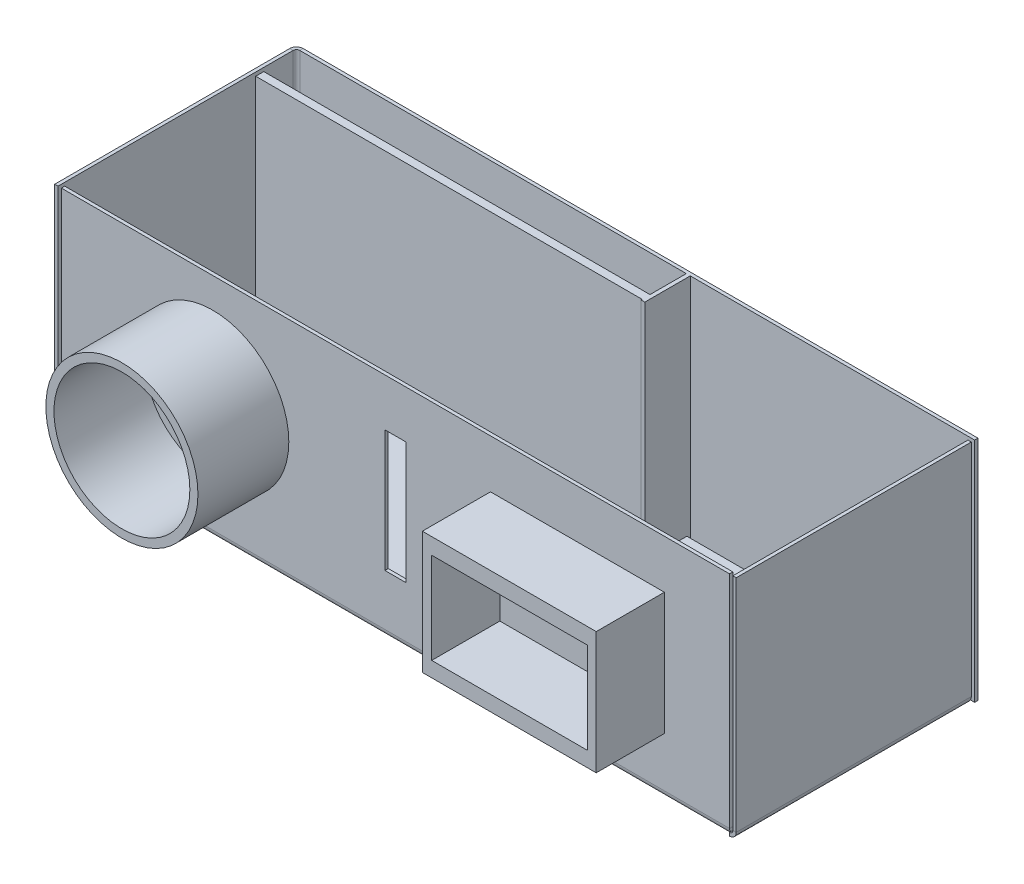
from build123d import *

# Parameters (mm, degrees)
SKETCH1_W                    = 150
SKETCH1_H                    = 50
BASE_FLANGE1_DEPTH           = 0.7366
EDGE_FLANGE2_STRIP_W         = 4.4196
EDGE_FLANGE2_STRIP_H         = 0.7366
EDGE_FLANGE2_STRIP_CUT_DEPTH = 50
EDGE_FLANGE2_DEPTH           = 50
EDGE_FLANGE3_STRIP_W         = 4.4196
EDGE_FLANGE3_STRIP_H         = 0.7366
EDGE_FLANGE3_STRIP_CUT_DEPTH = 51.7366
EDGE_FLANGE3_DEPTH           = 51.7366
EDGE_FLANGE5_STRIP_W         = 4.4196
EDGE_FLANGE5_STRIP_H         = 0.7366
EDGE_FLANGE5_STRIP_CUT_DEPTH = 51.7366
EDGE_FLANGE5_DEPTH           = 51.7366
EDGE_FLANGE6_STRIP_W         = 4.4196
EDGE_FLANGE6_STRIP_H         = 0.7366
EDGE_FLANGE6_STRIP_CUT_DEPTH = 147.0536
EDGE_FLANGE6_DEPTH           = 147.0536
SKETCH38_W                   = 4.66509895
SKETCH38_H                   = 26.811141958
CUT_EXTRUDE1_DEPTH           = 2
SKETCH40_R                   = 16.736303479
SKETCH40_R_2                 = 14.955594907
BOSS_EXTRUDE4_DEPTH          = 20
SKETCH42_W                   = 0.865074657
SKETCH42_H                   = 50
BOSS_EXTRUDE5_DEPTH          = 10
SKETCH57_W                   = 1.770321067
SKETCH57_H                   = 56.722896859
BOSS_EXTRUDE7_DEPTH          = 85
SKETCH60_W                   = 38.271407539
SKETCH60_H                   = 26.924897386
SKETCH60_W_2                 = 34.235775553
SKETCH60_H_2                 = 20.047107357
BOSS_EXTRUDE8_DEPTH          = 15
SKETCH61_R                   = 2.019782533
CUT_EXTRUDE3_DEPTH           = 2
SKETCH62_R                   = 1.571954748
BOSS_EXTRUDE9_DEPTH          = 3
SKETCH63_R                   = 7.10603058
BOSS_EXTRUDE10_DEPTH         = 1.5
SKETCH64_R                   = 6.980489156
SKETCH64_R_2                 = 6.226740222
BOSS_EXTRUDE11_DEPTH         = 15


# Sheet-metal steps are written as plain solids
with BuildPart() as part:
    # Sketch1 → Base-Flange1 (new body)
    with BuildSketch(Plane.XY):
        Rectangle(SKETCH1_W, SKETCH1_H)
    extrude(amount=-BASE_FLANGE1_DEPTH)

    # Edge-Flange2 strip (across the edge) → Edge-Flange2 strip cut (cut)
    with BuildSketch(Plane(origin=(-75, 25, 0), x_dir=(1, 0, 0), z_dir=(0, -1, 0))):
        with Locations((-0.7366, -0.3683)):
            Rectangle(EDGE_FLANGE2_STRIP_W, EDGE_FLANGE2_STRIP_H)
    extrude(amount=EDGE_FLANGE2_STRIP_CUT_DEPTH, mode=Mode.SUBTRACT)

    # Edge-Flange2 section (across the edge) → Edge-Flange2 (add)
    with BuildSketch(Plane(origin=(-75, 25, 0), x_dir=(1, 0, 0), z_dir=(0, -1, 0))):
        with BuildLine():
            Line((0, 0.7366), (0, 52.4732))
            Line((0, 52.4732), (0.7366, 52.4732))
            Line((0.7366, 52.4732), (0.7366, 0.7366))
            ThreePointArc((0.7366, 0.7366), (0.952345145, 0.215745145), (1.4732, 0))
            Line((1.4732, 0), (1.4732, -0.7366))
            ThreePointArc((1.4732, -0.7366), (0.43149029, -0.30510971), (0, 0.7366))
        make_face()
    extrude(amount=EDGE_FLANGE2_DEPTH)

    # Edge-Flange3 strip (across the edge) → Edge-Flange3 strip cut (cut)
    with BuildSketch(Plane(origin=(-74.2634, -25, 52.4732), x_dir=(0, 1, 0), z_dir=(0, 0, -1))):
        with Locations((-0.7366, -0.3683)):
            Rectangle(EDGE_FLANGE3_STRIP_W, EDGE_FLANGE3_STRIP_H)
    extrude(amount=EDGE_FLANGE3_STRIP_CUT_DEPTH, mode=Mode.SUBTRACT)

    # Edge-Flange3 section (across the edge) → Edge-Flange3 (add)
    with BuildSketch(Plane(origin=(-74.2634, -25, 52.4732), x_dir=(0, 1, 0), z_dir=(0, 0, -1))):
        with BuildLine():
            Line((0, 0.7366), (0, 149.2634))
            Line((0, 149.2634), (0.7366, 149.2634))
            Line((0.7366, 149.2634), (0.7366, 0.7366))
            ThreePointArc((0.7366, 0.7366), (0.952345145, 0.215745145), (1.4732, 0))
            Line((1.4732, 0), (1.4732, -0.7366))
            ThreePointArc((1.4732, -0.7366), (0.43149029, -0.30510971), (0, 0.7366))
        make_face()
    extrude(amount=EDGE_FLANGE3_DEPTH)

    # Edge-Flange5 strip (across the edge) → Edge-Flange5 strip cut (cut)
    with BuildSketch(Plane(origin=(75, -24.2634, 52.4732), x_dir=(-1, 0, 0), z_dir=(0, 0, -1))):
        with Locations((-0.7366, -0.3683)):
            Rectangle(EDGE_FLANGE5_STRIP_W, EDGE_FLANGE5_STRIP_H)
    extrude(amount=EDGE_FLANGE5_STRIP_CUT_DEPTH, mode=Mode.SUBTRACT)

    # Edge-Flange5 section (across the edge) → Edge-Flange5 (add)
    with BuildSketch(Plane(origin=(75, -24.2634, 52.4732), x_dir=(-1, 0, 0), z_dir=(0, 0, -1))):
        with BuildLine():
            Line((0, 0.7366), (0, 49.2634))
            Line((0, 49.2634), (0.7366, 49.2634))
            Line((0.7366, 49.2634), (0.7366, 0.7366))
            ThreePointArc((0.7366, 0.7366), (0.952345145, 0.215745145), (1.4732, 0))
            Line((1.4732, 0), (1.4732, -0.7366))
            ThreePointArc((1.4732, -0.7366), (0.43149029, -0.30510971), (0, 0.7366))
        make_face()
    extrude(amount=EDGE_FLANGE5_DEPTH)

    # Edge-Flange6 strip (across the edge) → Edge-Flange6 strip cut (cut)
    with BuildSketch(Plane(origin=(-73.5268, -24.2634, 52.4732), x_dir=(0, 0, -1), z_dir=(1, 0, 0))):
        with Locations((-0.7366, -0.3683)):
            Rectangle(EDGE_FLANGE6_STRIP_W, EDGE_FLANGE6_STRIP_H)
    extrude(amount=EDGE_FLANGE6_STRIP_CUT_DEPTH, mode=Mode.SUBTRACT)

    # Edge-Flange6 section (across the edge) → Edge-Flange6 (add)
    with BuildSketch(Plane(origin=(-73.5268, -24.2634, 52.4732), x_dir=(0, 0, -1), z_dir=(1, 0, 0))):
        with BuildLine():
            Line((0, 0.7366), (0, 49.2634))
            Line((0, 49.2634), (0.7366, 49.2634))
            Line((0.7366, 49.2634), (0.7366, 0.7366))
            ThreePointArc((0.7366, 0.7366), (0.952345145, 0.215745145), (1.4732, 0))
            Line((1.4732, 0), (1.4732, -0.7366))
            ThreePointArc((1.4732, -0.7366), (0.43149029, -0.30510971), (0, 0.7366))
        make_face()
    extrude(amount=EDGE_FLANGE6_DEPTH)

    # Sketch38 → Cut-Extrude1 (cut)
    with BuildSketch(Plane.XY.offset(52.4732)):
        with Locations((0, 1.125354672)):
            Rectangle(SKETCH38_W, SKETCH38_H)
    extrude(amount=-CUT_EXTRUDE1_DEPTH, mode=Mode.SUBTRACT)

    # Sketch40 → Boss-Extrude4 (add)
    with BuildSketch(Plane.XY.offset(52.4732)):
        with Locations((-40.204479975, 1.659887055)):
            Circle(SKETCH40_R)
        with Locations((-40.204479975, 1.659887055)):
            Circle(SKETCH40_R_2, mode=Mode.SUBTRACT)
    extrude(amount=BOSS_EXTRUDE4_DEPTH)

    # Sketch42 → Boss-Extrude5 (add)
    with BuildSketch(Plane.XY):
        with Locations((11.975597677, 0)):
            Rectangle(SKETCH42_W, SKETCH42_H)
    extrude(amount=BOSS_EXTRUDE5_DEPTH)

    # Sketch57 → Boss-Extrude7 (add)
    with BuildSketch(Plane.ZY.offset(-11.543060348)):
        with Locations((8.882085538, -3.36144843)):
            Rectangle(SKETCH57_W, SKETCH57_H)
    extrude(amount=BOSS_EXTRUDE7_DEPTH)

    # Sketch60 → Boss-Extrude8 (add)
    with BuildSketch(Plane.XY.offset(52.4732)):
        with Locations((40.051357612, 0.865314599)):
            Rectangle(SKETCH60_W, SKETCH60_H)
        with Locations((40.096607613, 0.750841138)):
            Rectangle(SKETCH60_W_2, SKETCH60_H_2, mode=Mode.SUBTRACT)
    extrude(amount=BOSS_EXTRUDE8_DEPTH)

    # Sketch61 → Cut-Extrude3 (cut)
    with BuildSketch(Plane(origin=(0, 0, 51.7366), x_dir=(-1, 0, 0), z_dir=(0, 0, -1))):
        with Locations((-47.658560575, 2.019782533)):
            Circle(SKETCH61_R)
    extrude(amount=-CUT_EXTRUDE3_DEPTH, mode=Mode.SUBTRACT)

    # Sketch62 → Boss-Extrude9 (add)
    with BuildSketch(Plane(origin=(0, 0, 51.7366), x_dir=(-1, 0, 0), z_dir=(0, 0, -1))):
        with Locations(Location((-63.948086172, 1.147200329, 0), (0, 0, 180))):
            Circle(SKETCH62_R)
    extrude(amount=BOSS_EXTRUDE9_DEPTH)

    # Sketch63 → Boss-Extrude10 (add)
    with BuildSketch(Plane(origin=(0, 0, 48.7366), x_dir=(-1, 0, 0), z_dir=(0, 0, -1))):
        with Locations((-63.631248371, 0.988840217)):
            Circle(SKETCH63_R)
    extrude(amount=BOSS_EXTRUDE10_DEPTH)

    # Sketch64 → Boss-Extrude11 (add)
    with BuildSketch(Plane(origin=(0, 0, 47.2366), x_dir=(-1, 0, 0), z_dir=(0, 0, -1))):
        with Locations(Location((-63.746933468, 0.733116553, 0), (0, 0, 181.202812621))):
            Circle(SKETCH64_R)
        with Locations((-63.746933468, 0.733116553)):
            Circle(SKETCH64_R_2, mode=Mode.SUBTRACT)
    extrude(amount=BOSS_EXTRUDE11_DEPTH)


solid = part.part
